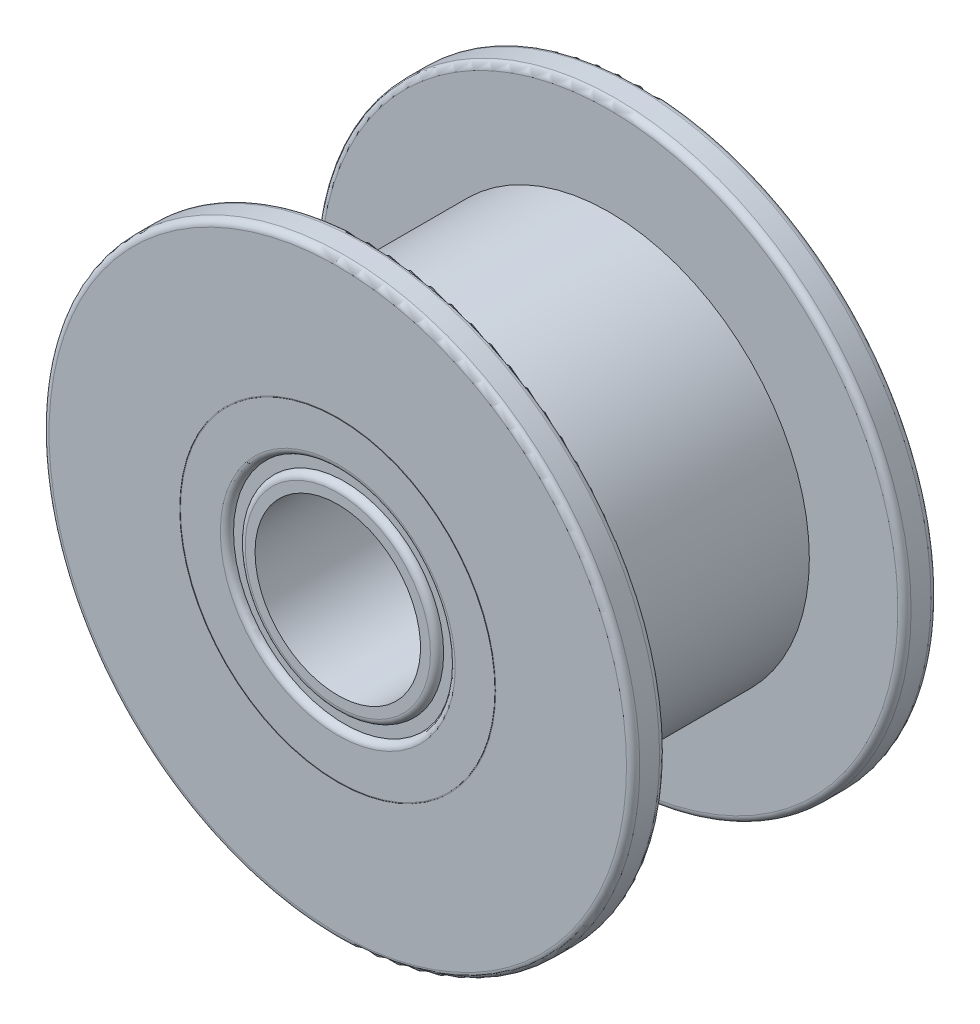
from build123d import *

# Parameters (mm, degrees)
P_IDAT_VYSUNUT_M1_DEPTH     = 7.2
ZAOBLIT1_R                  = 0.2
SKICA2_R                    = 8.925
P_IDAT_VYSUNUT_M2_DEPTH     = 1
P_IDAT_START                = 1
SKICA3_R                    = 8.925
P_IDAT_VYSUNUT_M3_DEPTH     = 1
SKICA23_R                   = 2.5
ODEBRAT_VYSUNUT_M4_DEPTH    = 16.618938824
SKICA25_R                   = 4.775
SKICA25_R_2                 = 4.75
ODEBRAT_VYSUNUT_M6_DEPTH    = 0.01
ODEBRAT_START               = -0.01
SKICA27_R                   = 4.775
SKICA27_R_2                 = 4.75
ODEBRAT_VYSUNUT_M7_DEPTH    = 0.01
P_IDAT_START_2              = -9.2
SKICA28_R                   = 3.5
SKICA28_R_2                 = 2.5
P_IDAT_VYSUNUT_M4_DEPTH     = 9.2
SKICA29_R                   = 3.35
SKICA29_R_2                 = 3
ODEBRAT_VYSUNUT_M8_DEPTH    = 0.2
ODEBRAT_START_2             = -0.2
SKICA30_R                   = 3.35
SKICA30_R_2                 = 3
ODEBRAT_VYSUNUT_M9_DEPTH    = 0.2
ZAOBLIT2_R                  = 0.2
ZAOBLIT3_R                  = 0.2
DODANIE_WYCI_GNI_CIE1_REACH = 17.052
SZKIC1_R                    = 6.5
SZKIC1_R_2                  = 2.5
WYTNIJ_WYCI_GNI_CIE2_START  = 7.2
SZKIC2_R                    = 6.5
SZKIC2_R_2                  = 6.05
WYTNIJ_WYCI_GNI_CIE2_DEPTH  = 7.2


with BuildPart() as part:
    # Skica1 → Přidat vysunutím1 (new body)
    with BuildSketch(Plane.XY):
        with BuildLine():
            Line((-0.5, 6.079473661), (-0.5, 5.577633907))
            ThreePointArc((-0.5, 5.577633907), (-0.876033004, 5.531054707), (-1.248055408, 5.45915357))
            Line((-1.248055408, 5.45915357), (-1.40313242, 5.936431539))
            ThreePointArc((-1.40313242, 5.936431539), (-1.885003666, 5.801444749), (-2.354188936, 5.627414544))
            Line((-2.354188936, 5.627414544), (-2.199111924, 5.150136576))
            ThreePointArc((-2.199111924, 5.150136576), (-2.542346799, 4.989636535), (-2.873942456, 4.806293245))
            Line((-2.873942456, 4.806293245), (-3.168916463, 5.212290135))
            ThreePointArc((-3.168916463, 5.212290135), (-3.585490039, 4.935003666), (-3.977933457, 4.624504883))
            Line((-3.977933457, 4.624504883), (-3.68295945, 4.218507993))
            ThreePointArc((-3.68295945, 4.218507993), (-3.959797975, 3.959797975), (-4.218507993, 3.68295945))
            Line((-4.218507993, 3.68295945), (-4.624504883, 3.977933457))
            ThreePointArc((-4.624504883, 3.977933457), (-4.935003666, 3.585490039), (-5.212290135, 3.168916463))
            Line((-5.212290135, 3.168916463), (-4.806293245, 2.873942456))
            ThreePointArc((-4.806293245, 2.873942456), (-4.989636535, 2.542346799), (-5.150136576, 2.199111924))
            Line((-5.150136576, 2.199111924), (-5.627414544, 2.354188936))
            ThreePointArc((-5.627414544, 2.354188936), (-5.801444749, 1.885003666), (-5.936431539, 1.40313242))
            Line((-5.936431539, 1.40313242), (-5.45915357, 1.248055408))
            ThreePointArc((-5.45915357, 1.248055408), (-5.531054707, 0.876033004), (-5.577633907, 0.5))
            Line((-5.577633907, 0.5), (-6.079473661, 0.5))
            ThreePointArc((-6.079473661, 0.5), (-6.1, 0), (-6.079473661, -0.5))
            Line((-6.079473661, -0.5), (-5.577633907, -0.5))
            ThreePointArc((-5.577633907, -0.5), (-5.531054707, -0.876033004), (-5.45915357, -1.248055408))
            Line((-5.45915357, -1.248055408), (-5.936431539, -1.40313242))
            ThreePointArc((-5.936431539, -1.40313242), (-5.801444749, -1.885003666), (-5.627414544, -2.354188936))
            Line((-5.627414544, -2.354188936), (-5.150136576, -2.199111924))
            ThreePointArc((-5.150136576, -2.199111924), (-4.989636535, -2.542346799), (-4.806293245, -2.873942456))
            Line((-4.806293245, -2.873942456), (-5.212290135, -3.168916463))
            ThreePointArc((-5.212290135, -3.168916463), (-4.935003666, -3.585490039), (-4.624504883, -3.977933457))
            Line((-4.624504883, -3.977933457), (-4.218507993, -3.68295945))
            ThreePointArc((-4.218507993, -3.68295945), (-3.959797975, -3.959797975), (-3.68295945, -4.218507993))
            Line((-3.68295945, -4.218507993), (-3.977933457, -4.624504883))
            ThreePointArc((-3.977933457, -4.624504883), (-3.585490039, -4.935003666), (-3.168916463, -5.212290135))
            Line((-3.168916463, -5.212290135), (-2.873942456, -4.806293245))
            ThreePointArc((-2.873942456, -4.806293245), (-2.542346799, -4.989636535), (-2.199111924, -5.150136576))
            Line((-2.199111924, -5.150136576), (-2.354188936, -5.627414544))
            ThreePointArc((-2.354188936, -5.627414544), (-1.885003666, -5.801444749), (-1.40313242, -5.936431539))
            Line((-1.40313242, -5.936431539), (-1.248055408, -5.45915357))
            ThreePointArc((-1.248055408, -5.45915357), (-0.876033004, -5.531054707), (-0.5, -5.577633907))
            Line((-0.5, -5.577633907), (-0.5, -6.079473661))
            ThreePointArc((-0.5, -6.079473661), (0, -6.1), (0.5, -6.079473661))
            Line((0.5, -6.079473661), (0.5, -5.577633907))
            ThreePointArc((0.5, -5.577633907), (0.876033004, -5.531054707), (1.248055408, -5.45915357))
            Line((1.248055408, -5.45915357), (1.40313242, -5.936431539))
            ThreePointArc((1.40313242, -5.936431539), (1.885003666, -5.801444749), (2.354188936, -5.627414544))
            Line((2.354188936, -5.627414544), (2.199111924, -5.150136576))
            ThreePointArc((2.199111924, -5.150136576), (2.542346799, -4.989636535), (2.873942456, -4.806293245))
            Line((2.873942456, -4.806293245), (3.168916463, -5.212290135))
            ThreePointArc((3.168916463, -5.212290135), (3.585490039, -4.935003666), (3.977933457, -4.624504883))
            Line((3.977933457, -4.624504883), (3.68295945, -4.218507993))
            ThreePointArc((3.68295945, -4.218507993), (3.959797975, -3.959797975), (4.218507993, -3.68295945))
            Line((4.218507993, -3.68295945), (4.624504883, -3.977933457))
            ThreePointArc((4.624504883, -3.977933457), (4.935003666, -3.585490039), (5.212290135, -3.168916463))
            Line((5.212290135, -3.168916463), (4.806293245, -2.873942456))
            ThreePointArc((4.806293245, -2.873942456), (4.989636535, -2.542346799), (5.150136576, -2.199111924))
            Line((5.150136576, -2.199111924), (5.627414544, -2.354188936))
            ThreePointArc((5.627414544, -2.354188936), (5.801444749, -1.885003666), (5.936431539, -1.40313242))
            Line((5.936431539, -1.40313242), (5.45915357, -1.248055408))
            ThreePointArc((5.45915357, -1.248055408), (5.531054707, -0.876033004), (5.577633907, -0.5))
            Line((5.577633907, -0.5), (6.079473661, -0.5))
            ThreePointArc((6.079473661, -0.5), (6.1, 0), (6.079473661, 0.5))
            Line((6.079473661, 0.5), (5.577633907, 0.5))
            ThreePointArc((5.577633907, 0.5), (5.531054707, 0.876033004), (5.45915357, 1.248055408))
            Line((5.45915357, 1.248055408), (5.936431539, 1.40313242))
            ThreePointArc((5.936431539, 1.40313242), (5.801444749, 1.885003666), (5.627414544, 2.354188936))
            Line((5.627414544, 2.354188936), (5.150136576, 2.199111924))
            ThreePointArc((5.150136576, 2.199111924), (4.989636535, 2.542346799), (4.806293245, 2.873942456))
            Line((4.806293245, 2.873942456), (5.212290135, 3.168916463))
            ThreePointArc((5.212290135, 3.168916463), (4.935003666, 3.585490039), (4.624504883, 3.977933457))
            Line((4.624504883, 3.977933457), (4.218507993, 3.68295945))
            ThreePointArc((4.218507993, 3.68295945), (3.959797975, 3.959797975), (3.68295945, 4.218507993))
            Line((3.68295945, 4.218507993), (3.977933457, 4.624504883))
            ThreePointArc((3.977933457, 4.624504883), (3.585490039, 4.935003666), (3.168916463, 5.212290135))
            Line((3.168916463, 5.212290135), (2.873942456, 4.806293245))
            ThreePointArc((2.873942456, 4.806293245), (2.542346799, 4.989636535), (2.199111924, 5.150136576))
            Line((2.199111924, 5.150136576), (2.354188936, 5.627414544))
            ThreePointArc((2.354188936, 5.627414544), (1.885003666, 5.801444749), (1.40313242, 5.936431539))
            Line((1.40313242, 5.936431539), (1.248055408, 5.45915357))
            ThreePointArc((1.248055408, 5.45915357), (0.876033004, 5.531054707), (0.5, 5.577633907))
            Line((0.5, 5.577633907), (0.5, 6.079473661))
            ThreePointArc((0.5, 6.079473661), (0, 6.1), (-0.5, 6.079473661))
        make_face()
    extrude(amount=P_IDAT_VYSUNUT_M1_DEPTH)

    # Zaoblit1
    zaoblit1_edges = [part.edges().sort_by_distance(p)[0] for p in [
        (0.5, 6.079473661, 3.6),
        (0.5, 5.577633907, 3.6),
        (1.248055408, 5.45915357, 3.6),
        (1.40313242, 5.936431539, 3.6),
        (2.354188936, 5.627414544, 3.6),
        (2.199111924, 5.150136576, 3.6),
        (2.873942456, 4.806293245, 3.6),
        (3.168916463, 5.212290135, 3.6),
        (3.977933457, 4.624504883, 3.6),
        (3.68295945, 4.218507993, 3.6),
        (4.218507993, 3.68295945, 3.6),
        (4.624504883, 3.977933457, 3.6),
        (5.212290135, 3.168916463, 3.6),
        (4.806293245, 2.873942456, 3.6),
        (5.150136576, 2.199111924, 3.6),
        (5.627414544, 2.354188936, 3.6),
        (5.936431539, 1.40313242, 3.6),
        (5.45915357, 1.248055408, 3.6),
        (5.577633907, 0.5, 3.6),
        (6.079473661, 0.5, 3.6),
        (6.079473661, -0.5, 3.6),
        (5.577633907, -0.5, 3.6),
        (5.45915357, -1.248055408, 3.6),
        (5.936431539, -1.40313242, 3.6),
        (5.627414544, -2.354188936, 3.6),
        (5.150136576, -2.199111924, 3.6),
        (4.806293245, -2.873942456, 3.6),
        (5.212290135, -3.168916463, 3.6),
        (4.624504883, -3.977933457, 3.6),
        (4.218507993, -3.68295945, 3.6),
        (3.68295945, -4.218507993, 3.6),
        (3.977933457, -4.624504883, 3.6),
        (3.168916463, -5.212290135, 3.6),
        (2.873942456, -4.806293245, 3.6),
        (2.199111924, -5.150136576, 3.6),
        (2.354188936, -5.627414544, 3.6),
        (1.40313242, -5.936431539, 3.6),
        (1.248055408, -5.45915357, 3.6),
        (0.5, -5.577633907, 3.6),
        (0.5, -6.079473661, 3.6),
        (-0.5, -6.079473661, 3.6),
        (-0.5, -5.577633907, 3.6),
        (-1.248055408, -5.45915357, 3.6),
        (-1.40313242, -5.936431539, 3.6),
        (-2.354188936, -5.627414544, 3.6),
        (-2.199111924, -5.150136576, 3.6),
        (-2.873942456, -4.806293245, 3.6),
        (-3.168916463, -5.212290135, 3.6),
        (-3.977933457, -4.624504883, 3.6),
        (-3.68295945, -4.218507993, 3.6),
        (-4.218507993, -3.68295945, 3.6),
        (-4.624504883, -3.977933457, 3.6),
        (-5.212290135, -3.168916463, 3.6),
        (-4.806293245, -2.873942456, 3.6),
        (-5.150136576, -2.199111924, 3.6),
        (-5.627414544, -2.354188936, 3.6),
        (-5.936431539, -1.40313242, 3.6),
        (-5.45915357, -1.248055408, 3.6),
        (-5.577633907, -0.5, 3.6),
        (-6.079473661, -0.5, 3.6),
        (-6.079473661, 0.5, 3.6),
        (-5.577633907, 0.5, 3.6),
        (-5.45915357, 1.248055408, 3.6),
        (-5.936431539, 1.40313242, 3.6),
        (-5.627414544, 2.354188936, 3.6),
        (-5.150136576, 2.199111924, 3.6),
        (-4.806293245, 2.873942456, 3.6),
        (-5.212290135, 3.168916463, 3.6),
        (-4.624504883, 3.977933457, 3.6),
        (-4.218507993, 3.68295945, 3.6),
        (-3.68295945, 4.218507993, 3.6),
        (-3.977933457, 4.624504883, 3.6),
        (-3.168916463, 5.212290135, 3.6),
        (-2.873942456, 4.806293245, 3.6),
        (-2.199111924, 5.150136576, 3.6),
        (-2.354188936, 5.627414544, 3.6),
        (-1.40313242, 5.936431539, 3.6),
        (-1.248055408, 5.45915357, 3.6),
        (-0.5, 5.577633907, 3.6),
        (-0.5, 6.079473661, 3.6),
    ]]
    fillet(zaoblit1_edges, radius=ZAOBLIT1_R)

    # Skica2 → Přidat vysunutím2 (add)
    with BuildSketch(Plane.XY.offset(7.2)):
        Circle(SKICA2_R)
    extrude(amount=P_IDAT_VYSUNUT_M2_DEPTH)

    # Skica3 → Přidat vysunutím3 (add)
    with BuildSketch(Plane(origin=(0, 0, 0), x_dir=(-1, 0, 0), z_dir=(0, 0, -1)).offset(P_IDAT_START)):
        with Locations(Location((0, 0, 0), (0, 0, 180))):
            Circle(SKICA3_R)
    extrude(amount=-P_IDAT_VYSUNUT_M3_DEPTH)

    # Skica23 → Odebrat vysunutím4 (cut, through all)
    with BuildSketch(Plane(origin=(0, 0, -1), x_dir=(-1, 0, 0), z_dir=(0, 0, -1))):
        Circle(SKICA23_R)
    extrude(amount=-ODEBRAT_VYSUNUT_M4_DEPTH, mode=Mode.SUBTRACT)

    # Skica25 → Odebrat vysunutím6 (cut)
    with BuildSketch(Plane.XY.offset(8.2)):
        Circle(SKICA25_R)
        Circle(SKICA25_R_2, mode=Mode.SUBTRACT)
    extrude(amount=-ODEBRAT_VYSUNUT_M6_DEPTH, mode=Mode.SUBTRACT)

    # Skica27 → Odebrat vysunutím7 (cut)
    with BuildSketch(Plane(origin=(0, 0, -1), x_dir=(-1, 0, 0), z_dir=(0, 0, -1)).offset(ODEBRAT_START)):
        with Locations(Location((0, 0, 0), (0, 0, 180))):
            Circle(SKICA27_R)
        with Locations(Location((0, 0, 0), (0, 0, 180))):
            Circle(SKICA27_R_2, mode=Mode.SUBTRACT)
    extrude(amount=ODEBRAT_VYSUNUT_M7_DEPTH, mode=Mode.SUBTRACT)

    # Skica28 → Přidat vysunutím4 (add)
    with BuildSketch(Plane.XY.offset(8.2).offset(P_IDAT_START_2)):
        Circle(SKICA28_R)
        with Locations(Location((0, 0, 0), (0, 0, 180))):
            Circle(SKICA28_R_2, mode=Mode.SUBTRACT)
    extrude(amount=P_IDAT_VYSUNUT_M4_DEPTH)

    # Skica29 → Odebrat vysunutím8 (cut)
    with BuildSketch(Plane.XY.offset(8.2)):
        Circle(SKICA29_R)
        Circle(SKICA29_R_2, mode=Mode.SUBTRACT)
    extrude(amount=-ODEBRAT_VYSUNUT_M8_DEPTH, mode=Mode.SUBTRACT)

    # Skica30 → Odebrat vysunutím9 (cut)
    with BuildSketch(Plane(origin=(0, 0, -1), x_dir=(-1, 0, 0), z_dir=(0, 0, -1)).offset(ODEBRAT_START_2)):
        with Locations(Location((0, 0, 0), (0, 0, 180))):
            Circle(SKICA30_R)
        with Locations(Location((0, 0, 0), (0, 0, 180))):
            Circle(SKICA30_R_2, mode=Mode.SUBTRACT)
    extrude(amount=ODEBRAT_VYSUNUT_M9_DEPTH, mode=Mode.SUBTRACT)

    # Zaoblit2
    zaoblit2_edges = [part.edges().sort_by_distance(p)[0] for p in [
        (-3.35, 0, 8.2),
        (-3, 0, 8.2),
        (-3.35, 0, -1),
        (-3, 0, -1),
    ]]
    fillet(zaoblit2_edges, radius=ZAOBLIT2_R - 0.0001)  # a hair under: the kernel refuses the full size

    # Zaoblit3
    zaoblit3_edges = [part.edges().sort_by_distance(p)[0] for p in [
        (-8.925, 0, 7.2),
        (-8.925, 0, 8.2),
        (-8.925, 0, 0),
        (-8.925, 0, -1),
    ]]
    fillet(zaoblit3_edges, radius=ZAOBLIT3_R)

    # Szkic1 → Dodanie-wyciągnięcie1 (add, up to next)
    with BuildSketch(Plane.XY, mode=Mode.PRIVATE) as dodanie_wyci_gni_cie1_sk1:
        with Locations(Location((0, 0, 0), (0, 0, 180))):
            Circle(SZKIC1_R)
        with Locations(Location((0, 0, 0), (0, 0, 180))):
            Circle(SZKIC1_R_2, mode=Mode.SUBTRACT)
    dodanie_wyci_gni_cie1_tool1 = extrude(dodanie_wyci_gni_cie1_sk1.sketch, amount=DODANIE_WYCI_GNI_CIE1_REACH, mode=Mode.PRIVATE) - part.part
    add(dodanie_wyci_gni_cie1_tool1.solids().sort_by_distance((6.316152, 0, 0))[0])

    # Szkic2 → Wytnij-wyciągnięcie2 (cut)
    with BuildSketch(Plane(origin=(0, 0, 7.2), x_dir=(-1, 0, 0), z_dir=(0, 0, -1)).offset(WYTNIJ_WYCI_GNI_CIE2_START)):
        Circle(SZKIC2_R)
        Circle(SZKIC2_R_2, mode=Mode.SUBTRACT)
    extrude(amount=-WYTNIJ_WYCI_GNI_CIE2_DEPTH, mode=Mode.SUBTRACT)


solid = part.part
